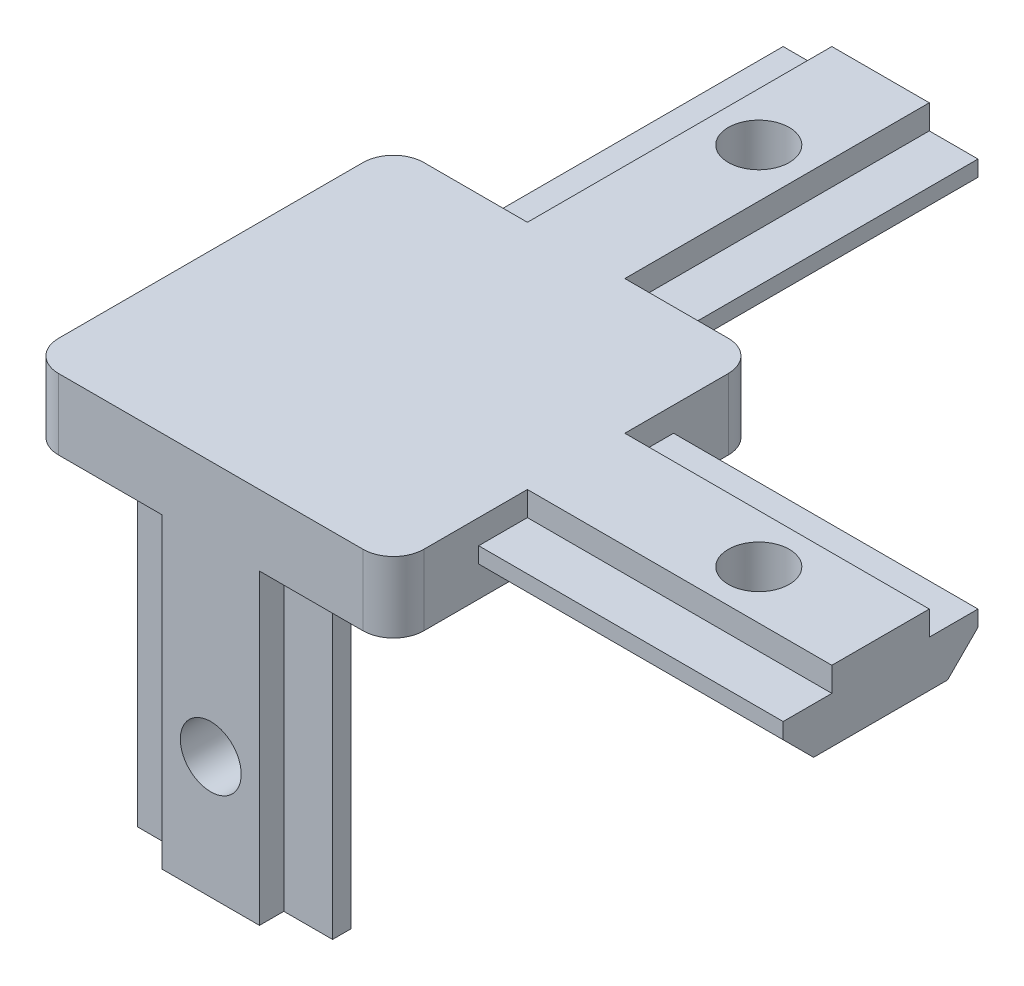
from build123d import *

# Parameters (mm, degrees)
SKETCH_1_W               = 30
SKETCH_1_H               = 30
EXTRUDE_1_DEPTH          = 5.8
EXTRUDE_2_DEPTH          = 25.2
SKETCH_3_W               = 18
SKETCH_3_H               = 18
CUT_EXTRUDE_1_DEPTH      = 1
EXTRUDE_4_DEPTH          = 25
PATTERN_CIRCULAR_1_COUNT = 2
PATTERN_CIRCULAR_1_ANGLE = 90
HOLE_WIZARD_M6_1_D       = 5
HOLE_WIZARD_M6_2_D       = 5
HOLE_WIZARD_M6_3_D       = 5
FILLET_1_R               = 2.5


with BuildPart() as part:
    # 草图1 → 凸台-拉伸1 (new body)
    with BuildSketch(Plane(origin=(0, 0, 0), x_dir=(1, 0, 0), z_dir=(0, 1, 0))):
        Rectangle(SKETCH_1_W, SKETCH_1_H)
    extrude(amount=EXTRUDE_1_DEPTH)

    # 草图2 → 凸台-拉伸2 (add)
    with BuildSketch(Plane(origin=(0, 0, 0), x_dir=(-1, 0, 0), z_dir=(0, -1, 0))):
        Polygon((4, -15), (4, -13), (8, -13), (8, -11.5), (5.5, -9), (-5.5, -9), (-8, -11.5), (-8, -13), (-4, -13), (-4, -15), align=None)
        Polygon((15, 4), (13, 4), (13, 8), (11.5, 8), (9, 5.5), (9, -5.5), (11.5, -8), (13, -8), (13, -4), (15, -4), align=None)
    extrude(amount=EXTRUDE_2_DEPTH)

    # 草图3 → 切除-拉伸1 (cut)
    with BuildSketch(Plane.XZ):
        Rectangle(SKETCH_3_W, SKETCH_3_H)
    extrude(amount=-CUT_EXTRUDE_1_DEPTH, mode=Mode.SUBTRACT)

    # 草图5 → 凸台-拉伸4 (add)
    with BuildSketch(Plane(origin=(0, 0, -15), x_dir=(-1, 0, 0), z_dir=(0, 0, -1))):
        Polygon((-5.5, 0), (5.5, 0), (8, 2.5), (8, 3.8), (4, 3.8), (4, 5.8), (-4, 5.8), (-4, 3.8), (-8, 3.8), (-8, 2.5), align=None)
    extrude_4 = extrude(amount=EXTRUDE_4_DEPTH)

    # 阵列(圆周)1: 凸台-拉伸4 ×2 about axis
    pattern_circular_1_axis = Axis((0, 0, 0), (0, -1, 0))
    for i in range(1, PATTERN_CIRCULAR_1_COUNT):
        add(extrude_4.rotate(pattern_circular_1_axis, i * PATTERN_CIRCULAR_1_ANGLE / (PATTERN_CIRCULAR_1_COUNT - 1)))

    # M6 螺纹孔1 (through all)
    with Locations(Plane(origin=(0, 0, 0), x_dir=(-1, 0, 0), z_dir=(0, -1, 0))):
        with Locations((-30, 0), (0, 30)):
            Hole(HOLE_WIZARD_M6_1_D / 2)

    # M6 螺纹孔2 (through all)
    with Locations(Plane.ZY.offset(15)):
        with Locations((0, -15.2)):
            Hole(HOLE_WIZARD_M6_2_D / 2)

    # M6 螺纹孔3 (through all)
    with Locations(Plane.XY.offset(15)):
        with Locations((0, -15.2)):
            Hole(HOLE_WIZARD_M6_3_D / 2)

    # 圆角1
    fillet_1_edges = [part.edges().sort_by_distance(p)[0] for p in [
        (15, 2.9, 15),
        (15, 2.9, -15),
        (-15, 2.9, -15),
        (-15, 2.9, 15),
    ]]
    fillet(fillet_1_edges, radius=FILLET_1_R)


solid = part.part
